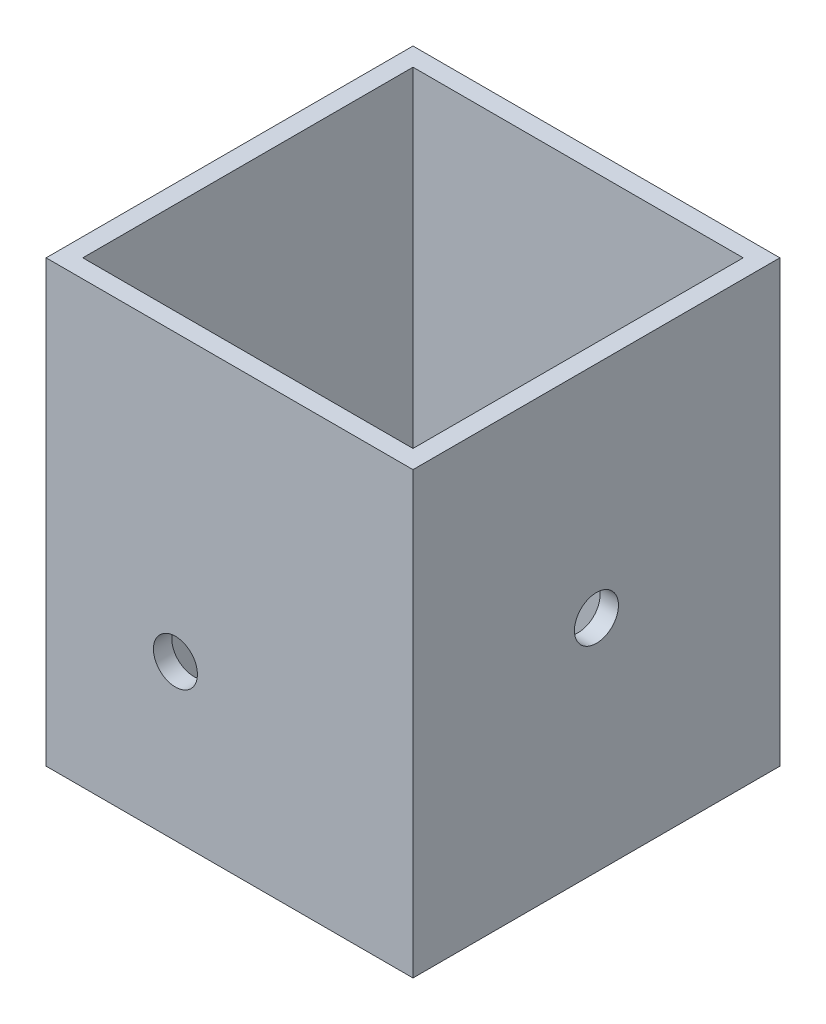
from build123d import *

# Parameters (mm, degrees)
SKETCH1_W           = 25
SKETCH1_H           = 25
SKETCH1_W_2         = 22.500853306
SKETCH1_H_2         = 22.500853306
BOSS_EXTRUDE1_DEPTH = 30
SKETCH2_R           = 1.5
CUT_EXTRUDE1_DEPTH  = 42.003048667
SKETCH3_R           = 1.5
CUT_EXTRUDE2_DEPTH  = 42.003048667


with BuildPart() as part:
    # Sketch1 → Boss-Extrude1 (new body)
    with BuildSketch(Plane(origin=(0, 0, 0), x_dir=(1, 0, 0), z_dir=(0, 1, 0))):
        Rectangle(SKETCH1_W, SKETCH1_H)
        Rectangle(SKETCH1_W_2, SKETCH1_H_2, mode=Mode.SUBTRACT)
    extrude(amount=BOSS_EXTRUDE1_DEPTH)

    # Sketch2 → Cut-Extrude1 (cut, through all)
    with BuildSketch(Plane(origin=(0, 0, -12.5), x_dir=(-1, 0, 0), z_dir=(0, 0, -1))):
        with Locations((3.68852459, 10.573770492)):
            Circle(SKETCH2_R)
    extrude(amount=-CUT_EXTRUDE1_DEPTH, mode=Mode.SUBTRACT)

    # Sketch3 → Cut-Extrude2 (cut, through all)
    with BuildSketch(Plane(origin=(12.5, 0, 0), x_dir=(0, 0, -1), z_dir=(1, 0, 0))):
        with Locations((0, 15)):
            Circle(SKETCH3_R)
    extrude(amount=-CUT_EXTRUDE2_DEPTH, mode=Mode.SUBTRACT)


solid = part.part
